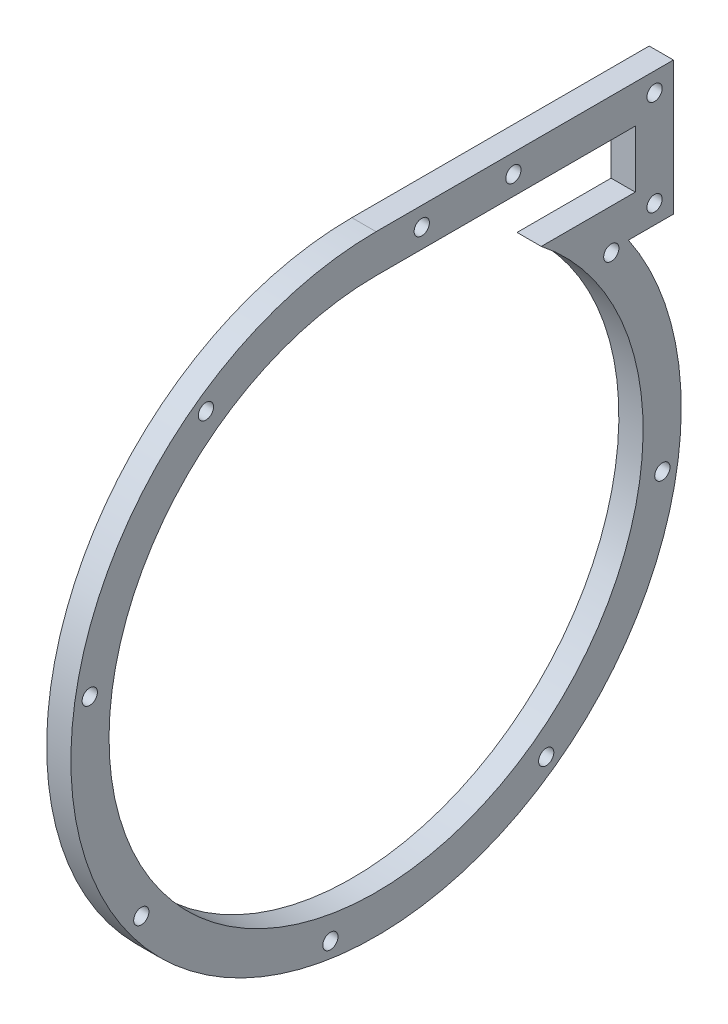
from build123d import *

# Parameters (mm, degrees)
BOSS_EXTRUDE1_DEPTH = 6.35
SKETCH2_R           = 2
CUT_EXTRUDE1_DEPTH  = 114.315146825


with BuildPart() as part:
    # Sketch1 → Boss-Extrude1 (new body)
    with BuildSketch(Plane(origin=(0, 0, 0), x_dir=(0, 0, -1), z_dir=(1, 0, 0))):
        with BuildLine():
            Line((0, 80), (77.95, 80))
            Line((77.95, 80), (77.95, 45))
            Line((77.95, 45), (66.143782777, 45))
            ThreePointArc((66.143782777, 45), (-37.416573868, -70.710678119), (0, 80))
        make_face()
        with BuildLine():
            Line((67.95, 55), (43.301270189, 55))
            ThreePointArc((43.301270189, 55), (-22.912878475, -66.143782777), (0, 70))
            Line((0, 70), (67.95, 70))
            Line((67.95, 70), (67.95, 55))
        make_face(mode=Mode.SUBTRACT)
    extrude(amount=BOSS_EXTRUDE1_DEPTH)

    # Sketch2 → Cut-Extrude1 (cut, through all)
    with BuildSketch(Plane(origin=(6.35, 0, 0), x_dir=(0, 0, -1), z_dir=(1, 0, 0))):
        with Locations((73, 75.05)):
            Circle(SKETCH2_R)
        with Locations((73, 49.95)):
            Circle(SKETCH2_R)
        with Locations((61.665635624, 44.422397314)):
            Circle(SKETCH2_R)
        with Locations((75.05, -11.979044202)):
            Circle(SKETCH2_R)
        with Locations((44.59790054, -61.538827316)):
            Circle(SKETCH2_R)
        with Locations((-11.979044202, -75.05)):
            Circle(SKETCH2_R)
        with Locations((-61.538827316, -44.59790054)):
            Circle(SKETCH2_R)
        with Locations((-75.05, 11.979044202)):
            Circle(SKETCH2_R)
        with Locations((-44.59790054, 61.538827316)):
            Circle(SKETCH2_R)
        with Locations((11.979044202, 75.05)):
            Circle(SKETCH2_R)
        with Locations((36, 75.05)):
            Circle(SKETCH2_R)
    extrude(amount=-CUT_EXTRUDE1_DEPTH, mode=Mode.SUBTRACT)


solid = part.part
